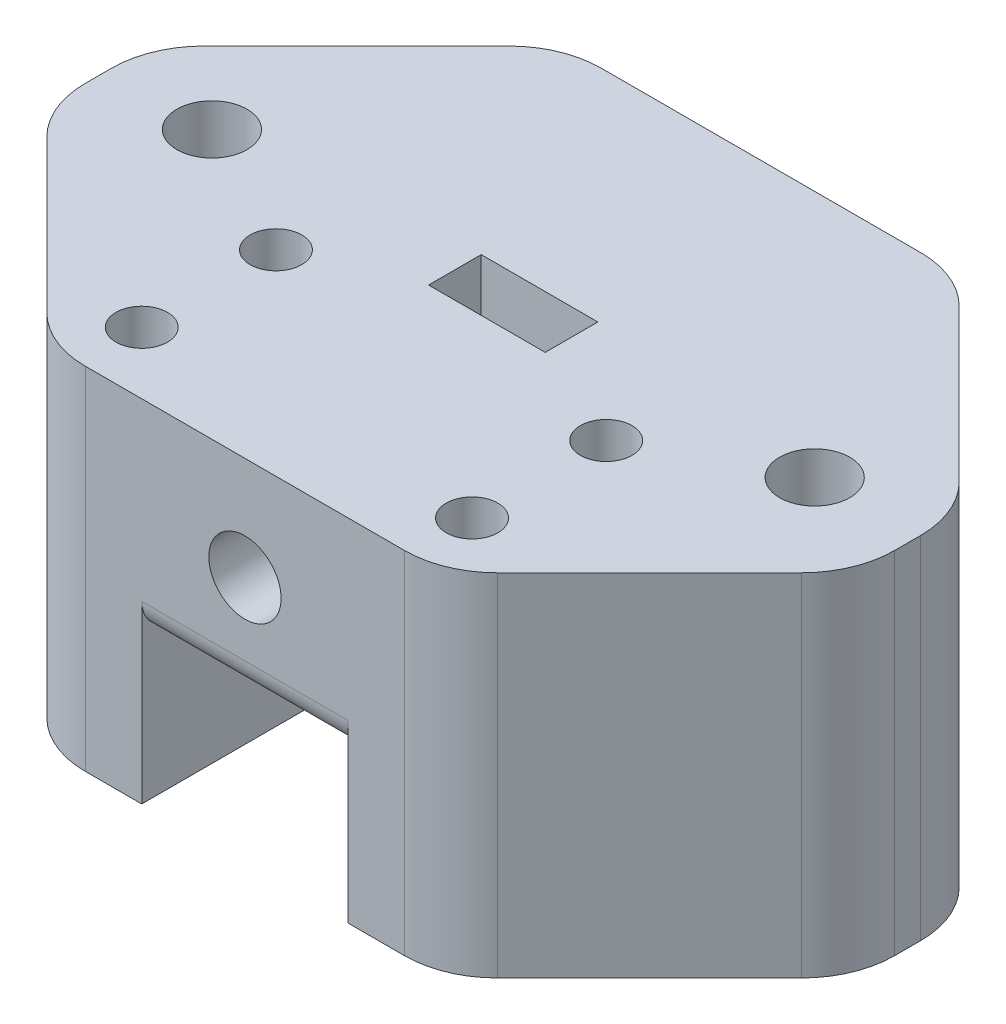
from build123d import *

# Parameters (mm, degrees)
SKETCH1_W                      = 39.2
SKETCH1_H                      = 25
BOSS_EXTRUDE1_DEPTH            = 10
F_3_5_3_5_DIAMETER_HOLE1_D     = 3.5
SKETCH9_W                      = 14.6
SKETCH9_H                      = 25
BOSS_EXTRUDE2_DEPTH            = 7
SKETCH10_W                     = 5.65
SKETCH10_H                     = 2.55
CUT_EXTRUDE4_DEPTH             = 10
F_2_5_2_5_DIAMETER_HOLE1_D     = 2.5
F_2_5_2_5_DIAMETER_HOLE1_DEPTH = 7
F_2_5_2_5_DIAMETER_HOLE1_TIP   = 0.751075774
F_3_4_3_4_DIAMETER_HOLE1_D     = 3.4
CHAMFER1_SIZE                  = 10
FILLET5_R                      = 4.5
FILLET6_R                      = 1.5


with BuildPart() as part:
    # Sketch1 → Boss-Extrude1 (new body)
    with BuildSketch(Plane(origin=(0, 0, 0), x_dir=(1, 0, 0), z_dir=(0, 1, 0))):
        with Locations((19.6, 12.5)):
            Rectangle(SKETCH1_W, SKETCH1_H)
    extrude(amount=BOSS_EXTRUDE1_DEPTH)

    # Ø3.5 (3.5) Diameter Hole1 (through all)
    with Locations(Plane(origin=(0, 0, -25), x_dir=(-1, 0, 0), z_dir=(0, 0, -1))):
        with Locations((-19.6, 5)):
            Hole(F_3_5_3_5_DIAMETER_HOLE1_D / 2)

    # Sketch9 → Boss-Extrude2 (add)
    with BuildSketch(Plane.XZ):
        with Locations((31.9, -12.5)):
            Rectangle(SKETCH9_W, SKETCH9_H)
        with Locations((7.3, -12.5)):
            Rectangle(SKETCH9_W, SKETCH9_H)
    extrude(amount=BOSS_EXTRUDE2_DEPTH)

    # Sketch10 → Cut-Extrude4 (cut)
    with BuildSketch(Plane(origin=(0, 10, 0), x_dir=(1, 0, 0), z_dir=(0, 1, 0))):
        with Locations((19.6, 12.995)):
            Rectangle(SKETCH10_W, SKETCH10_H)
    extrude(amount=-CUT_EXTRUDE4_DEPTH, mode=Mode.SUBTRACT)

    # Ø2.5 (2.5) Diameter Hole1
    with Locations(Plane(origin=(0, 10, 0), x_dir=(1, 0, 0), z_dir=(0, 1, 0))):
        with Locations((11.6, 3), (27.6, 3), (27.6, 9.5), (11.6, 9.5)):
            Hole(F_2_5_2_5_DIAMETER_HOLE1_D / 2, depth=F_2_5_2_5_DIAMETER_HOLE1_DEPTH)
            with Locations((0, 0, -(F_2_5_2_5_DIAMETER_HOLE1_DEPTH + F_2_5_2_5_DIAMETER_HOLE1_TIP / 2))):  # 118° drill point
                Cone(0, F_2_5_2_5_DIAMETER_HOLE1_D / 2, F_2_5_2_5_DIAMETER_HOLE1_TIP, mode=Mode.SUBTRACT)

    # Ø3.4 (3.4) Diameter Hole1 (through all)
    with Locations(Plane(origin=(0, 10, 0), x_dir=(1, 0, 0), z_dir=(0, 1, 0))):
        with Locations((34.2, 13), (5, 13)):
            Hole(F_3_4_3_4_DIAMETER_HOLE1_D / 2)

    # Chamfer1
    chamfer1_edges = [part.edges().sort_by_distance(p)[0] for p in [
        (0, 1.5, -25),
        (0, 1.5, 0),
        (39.2, 1.5, 0),
        (39.2, 1.5, -25),
    ]]
    chamfer(chamfer1_edges, length=CHAMFER1_SIZE)

    # Fillet5
    fillet5_edges = [part.edges().sort_by_distance(p)[0] for p in [
        (29.2, 1.5, 0),
        (10, 1.5, 0),
        (0, 1.5, -10),
        (0, 1.5, -15),
        (10, 1.5, -25),
        (29.2, 1.5, -25),
        (39.2, 1.5, -10),
        (39.2, 1.5, -15),
    ]]
    fillet(fillet5_edges, radius=FILLET5_R)

    # Fillet6
    fillet6_edges = [part.edges().sort_by_distance(p)[0] for p in [
        (19.6, 0, 0),
    ]]
    fillet(fillet6_edges, radius=FILLET6_R)


solid = part.part
